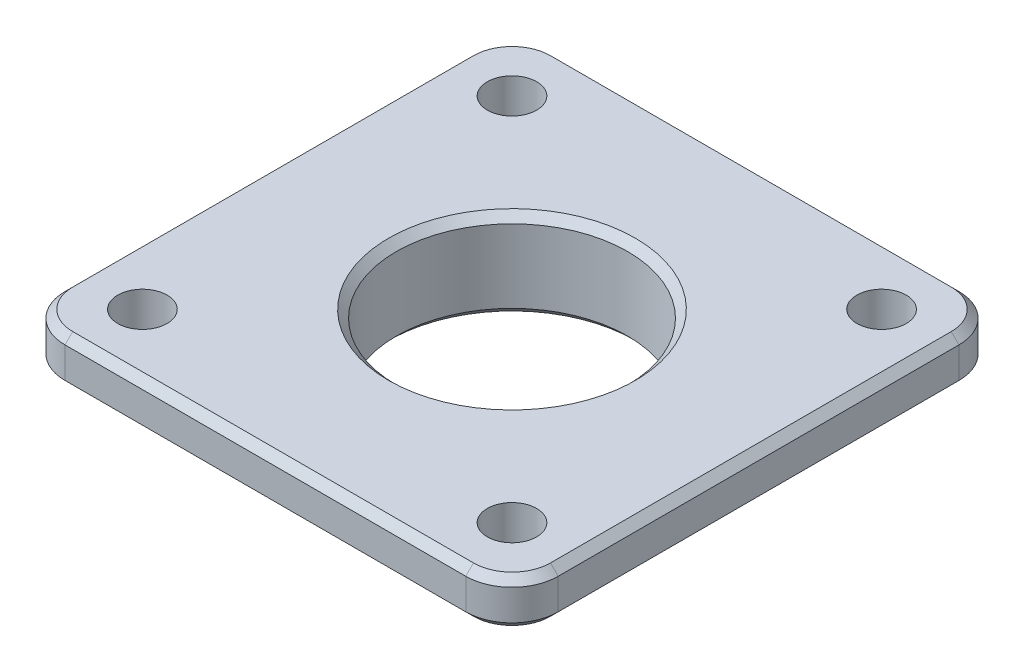
from build123d import *

# Parameters (mm, degrees)
SKIZZE1_R                       = 7.5
SKIZZE1_R_2                     = 1.6
AUFSATZ_LINEAR_AUSTRAGEN1_DEPTH = 3
AUFSATZ_LINEAR_START            = 2.75
SKIZZE2_R                       = 12.3
SKIZZE2_R_2                     = 7.5
AUFSATZ_LINEAR_AUSTRAGEN2_DEPTH = 2.75
FASE1_SIZE                      = 0.5


with BuildPart() as part:
    # Skizze1 → Aufsatz-Linear austragen1 (new body)
    with BuildSketch(Plane(origin=(0, 0, 0), x_dir=(1, 0, 0), z_dir=(0, 1, 0))):
        with BuildLine():
            Line((-16, -13), (-16, 13))
            ThreePointArc((-16, 13), (-15.121320344, 15.121320344), (-13, 16))
            Line((-13, 16), (13, 16))
            ThreePointArc((13, 16), (15.121320344, 15.121320344), (16, 13))
            Line((16, 13), (16, -13))
            ThreePointArc((16, -13), (15.121320344, -15.121320344), (13, -16))
            Line((13, -16), (-13, -16))
            ThreePointArc((-13, -16), (-15.121320344, -15.121320344), (-16, -13))
        make_face()
        Circle(SKIZZE1_R, mode=Mode.SUBTRACT)
        with Locations((-11.988995475, 11.988995475)):
            Circle(SKIZZE1_R_2, mode=Mode.SUBTRACT)
        with Locations((11.988995475, 11.988995475)):
            Circle(SKIZZE1_R_2, mode=Mode.SUBTRACT)
        with Locations((11.988995475, -11.988995475)):
            Circle(SKIZZE1_R_2, mode=Mode.SUBTRACT)
        with Locations((-11.988995475, -11.988995475)):
            Circle(SKIZZE1_R_2, mode=Mode.SUBTRACT)
    extrude(amount=AUFSATZ_LINEAR_AUSTRAGEN1_DEPTH)

    # Skizze2 → Aufsatz-Linear austragen2 (add)
    with BuildSketch(Plane.XZ.offset(AUFSATZ_LINEAR_START)):
        Circle(SKIZZE2_R)
        Circle(SKIZZE2_R_2, mode=Mode.SUBTRACT)
    extrude(amount=-AUFSATZ_LINEAR_AUSTRAGEN2_DEPTH)

    # Fase1
    fase1_edges = [part.edges().sort_by_distance(p)[0] for p in [
        (16, 0, 0),
        (15.121320344, 0, -15.121320344),
        (15.121320344, 0, 15.121320344),
        (0, 0, -16),
        (0, 0, 16),
        (-15.121320344, 0, -15.121320344),
        (-15.121320344, 0, 15.121320344),
        (-16, 0, 0),
        (16, 3, 0),
        (15.121320344, 3, -15.121320344),
        (15.121320344, 3, 15.121320344),
        (0, 3, -16),
        (0, 3, 16),
        (-15.121320344, 3, -15.121320344),
        (-15.121320344, 3, 15.121320344),
        (-16, 3, 0),
        (-7.5, 3, 0),
        (-7.5, -2.75, 0),
        (-12.3, -2.75, 0),
    ]]
    chamfer(fase1_edges, length=FASE1_SIZE)


solid = part.part
